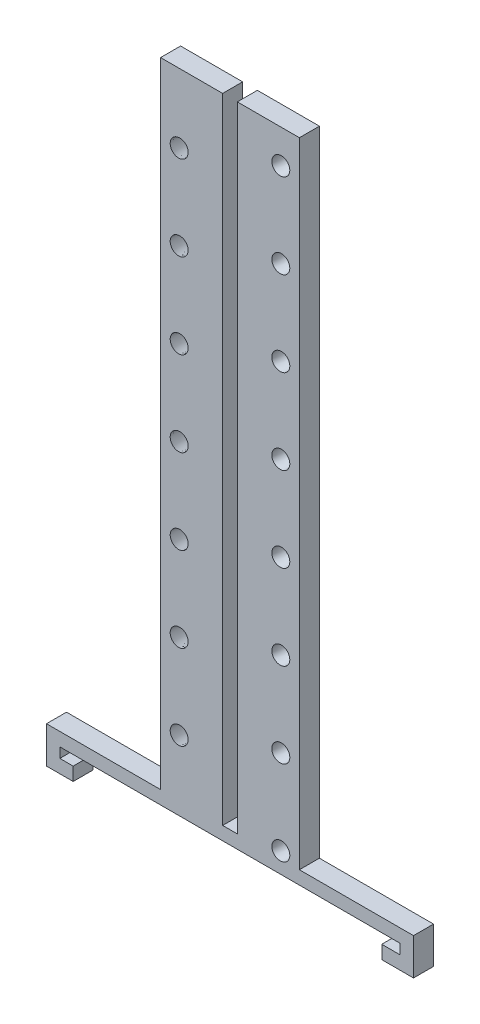
from build123d import *

# Parameters (mm, degrees)
SALIENTE_EXTRUIR1_DEPTH    = 3
CORTAR_BARRER1_PITCH       = 12.7
CORTAR_BARRER1_HEIGHT      = 101.6
CORTAR_BARRER1_RADIUS      = 7.88
CORTAR_BARRER1_START_ANGLE = 45
CROQUIS4_R                 = 1.3


with BuildPart() as part:
    # Croquis1 → Saliente-Extruir1 (new body)
    with BuildSketch(Plane.XY):
        Polygon((-72.861494701, -40.767663043), (-68.861494701, -40.767663043), (-68.861494701, -38.767663043), (-70.861494701, -38.767663043), (-70.861494701, -37.267663043), (-19.861494701, -37.267663043), (-19.861494701, -38.767663043), (-22.618543213, -38.767663043), (-22.618543213, -40.767663043), (-17.861494701, -40.767663043), (-17.861494701, -35.267663043), (-34.961494701, -35.267663043), (-34.961494701, 59.732336957), (-44.261494701, 59.732336957), (-44.261494701, -35.267663043), (-46.461494701, -35.267663043), (-46.461494701, 59.732336957), (-55.761494701, 59.732336957), (-55.761494701, -35.267663043), (-72.861494701, -35.267663043), align=None)
    extrude(amount=SALIENTE_EXTRUIR1_DEPTH)

    # Cortar-Barrer1: sweep along a helix
    with BuildLine() as cortar_barrer1_path:
        add(Helix(CORTAR_BARRER1_PITCH, CORTAR_BARRER1_HEIGHT, CORTAR_BARRER1_RADIUS, center=(-45.361494701, -35.267663043, 1), direction=(0, 1, 0), mode=Mode.PRIVATE).rotate(Axis((-45.361494701, -35.267663043, 1), (0, 1, 0)), CORTAR_BARRER1_START_ANGLE))
    # Croquis4 → Cortar-Barrer1 (sweep, cut)
    with BuildSketch(Plane(origin=(-39.789493266, 66.332336957, 6.572001436), x_dir=(0.6438777247419181, 0.23356944762691828, 0.7286060586602524), z_dir=(0.6849329976599197, 0.24846242660213974, -0.6849329976600433))):
        with Locations((0.000565959, 0.001324015)):
            Circle(CROQUIS4_R)
    sweep(path=cortar_barrer1_path.line, is_frenet=True, mode=Mode.SUBTRACT)


solid = part.part
